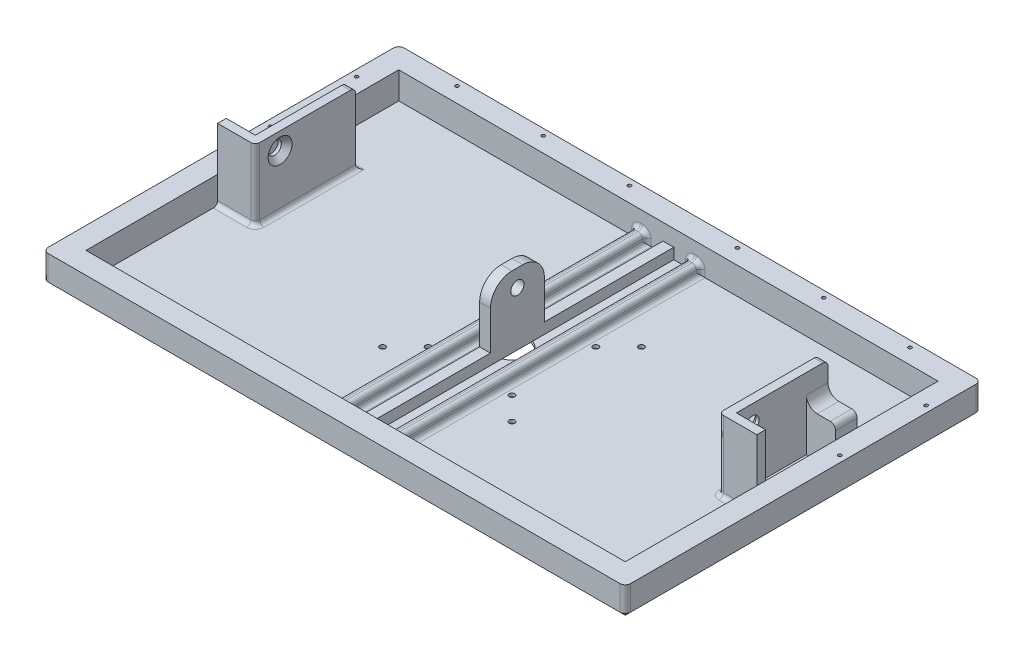
from build123d import *

# Parameters (mm, degrees)
SKETCH1_W           = 540
SKETCH1_H           = 330
BOSS_EXTRUDE1_DEPTH = 3
SKETCH2_W           = 540
SKETCH2_H           = 330
SKETCH2_W_2         = 500
SKETCH2_H_2         = 290
BOSS_EXTRUDE2_DEPTH = 25
FILLET1_R           = 5
SKETCH4_R           = 1.6
CUT_EXTRUDE1_DEPTH  = 28
SKETCH5_R           = 15
CUT_EXTRUDE2_DEPTH  = 3
SKETCH6_W           = 10
SKETCH6_H           = 290
BOSS_EXTRUDE3_DEPTH = 10
FILLET3_R           = 4
CHAMFER1_SIZE       = 5
SKETCH7_R           = 2.6
CUT_EXTRUDE3_DEPTH  = 3
SKETCH9_R           = 2.6
CUT_EXTRUDE4_DEPTH  = 47
SKETCH11_W          = 8
SKETCH11_H          = 140
BOSS_EXTRUDE4_DEPTH = 66
SKETCH12_R          = 6.1
CUT_EXTRUDE5_DEPTH  = 8
SKETCH13_W          = 8
SKETCH13_H          = 69
SKETCH13_W_2        = 20
SKETCH13_H_2        = 40.75
BOSS_EXTRUDE5_DEPTH = 27
SKETCH15_W          = 8
SKETCH15_H          = 47
CUT_EXTRUDE6_DEPTH  = 66
FILLET4_R           = 4
FILLET5_R           = 10
FILLET6_R           = 5
FILLET7_R           = 5
CHAMFER2_SIZE       = 5
SKETCH19_W          = 10
SKETCH19_H          = 290
BOSS_EXTRUDE6_DEPTH = 10
SKETCH20_W          = 10
SKETCH20_H          = 50
BOSS_EXTRUDE7_DEPTH = 56
FILLET8_R           = 20
SKETCH21_R          = 6.1
CUT_EXTRUDE7_DEPTH  = 10


with BuildPart() as part:
    # Sketch1 → Boss-Extrude1 (new body)
    with BuildSketch(Plane(origin=(0, 0, 0), x_dir=(1, 0, 0), z_dir=(0, 1, 0))):
        Rectangle(SKETCH1_W, SKETCH1_H)
    extrude(amount=BOSS_EXTRUDE1_DEPTH)

    # Sketch2 → Boss-Extrude2 (add)
    with BuildSketch(Plane(origin=(0, 3, 0), x_dir=(1, 0, 0), z_dir=(0, 1, 0))):
        Rectangle(SKETCH2_W, SKETCH2_H)
        Rectangle(SKETCH2_W_2, SKETCH2_H_2, mode=Mode.SUBTRACT)
    extrude(amount=BOSS_EXTRUDE2_DEPTH)

    # Fillet1
    fillet1_edges = [part.edges().sort_by_distance(p)[0] for p in [
        (270, 14, 165),
        (-270, 14, 165),
        (-270, 14, -165),
        (270, 14, -165),
    ]]
    fillet(fillet1_edges, radius=FILLET1_R)

    # Sketch4 → Cut-Extrude1 (cut)
    with BuildSketch(Plane(origin=(0, 28, 0), x_dir=(1, 0, 0), z_dir=(0, 1, 0))):
        with Locations(Location((-264, 120, 0), (0, 0, 270))):
            Circle(SKETCH4_R)
        with Locations(Location((-264, 40, 0), (0, 0, 270))):
            Circle(SKETCH4_R)
        with Locations(Location((-210, 159, 0), (0, 0, 270))):
            Circle(SKETCH4_R)
        with Locations(Location((-130, 159, 0), (0, 0, 270))):
            Circle(SKETCH4_R)
        with Locations(Location((-50, 159, 0), (0, 0, 270))):
            Circle(SKETCH4_R)
        with Locations(Location((50, 159, 0), (0, 0, 90))):
            Circle(SKETCH4_R)
        with Locations(Location((130, 159, 0), (0, 0, 90))):
            Circle(SKETCH4_R)
        with Locations(Location((210, 159, 0), (0, 0, 90))):
            Circle(SKETCH4_R)
        with Locations(Location((264, 40, 0), (0, 0, 90))):
            Circle(SKETCH4_R)
        with Locations(Location((264, 120, 0), (0, 0, 90))):
            Circle(SKETCH4_R)
    extrude(amount=-CUT_EXTRUDE1_DEPTH, mode=Mode.SUBTRACT)

    # Sketch5 → Cut-Extrude2 (cut)
    with BuildSketch(Plane(origin=(0, 3, 0), x_dir=(1, 0, 0), z_dir=(0, 1, 0))):
        with Locations(Location((0, 0, 0), (0, 0, 270))):
            Circle(SKETCH5_R)
    extrude(amount=-CUT_EXTRUDE2_DEPTH, mode=Mode.SUBTRACT)

    # Sketch6 → Boss-Extrude3 (add)
    with BuildSketch(Plane(origin=(0, 3, 0), x_dir=(1, 0, 0), z_dir=(0, 1, 0))):
        with Locations((25, 0)):
            Rectangle(SKETCH6_W, SKETCH6_H)
        with Locations((-25, 0)):
            Rectangle(SKETCH6_W, SKETCH6_H)
    extrude(amount=BOSS_EXTRUDE3_DEPTH)

    # Fillet3
    fillet3_edges = [part.edges().sort_by_distance(p)[0] for p in [
        (30, 3, 0),
        (30, 8, 145),
        (30, 8, -145),
        (20, 3, 0),
        (20, 8, -145),
        (20, 8, 145),
        (30, 13, 0),
        (25, 13, -145),
        (20, 13, 0),
        (25, 13, 145),
        (-20, 3, 0),
        (-20, 8, 145),
        (-20, 8, -145),
        (-30, 3, 0),
        (-30, 8, -145),
        (-30, 8, 145),
        (-20, 13, 0),
        (-25, 13, -145),
        (-30, 13, 0),
        (-25, 13, 145),
    ]]
    fillet(fillet3_edges, radius=FILLET3_R)

    # Chamfer1
    # the kernel refuses this chamfer: 5 mm, written as the material it takes off along each edge
    with BuildSketch(Plane(origin=(-270, 0, -160), x_dir=(0, 1, 0), z_dir=(0, 0, 1)), Plane(origin=(270, 0, 160), x_dir=(0, 1, 0), z_dir=(0, 0, -1))) as chamfer1_piece_1:
        Polygon((CHAMFER1_SIZE, 0), (0, -CHAMFER1_SIZE), (0, 0), align=None)
    extrude(amount=320, mode=Mode.SUBTRACT)
    with BuildSketch(Plane(origin=(-265, 0, 165), x_dir=(0, 1, 0), z_dir=(1, 0, 0)), Plane(origin=(265, 0, -165), x_dir=(0, 1, 0), z_dir=(-1, 0, 0))) as chamfer1_piece_2:
        Polygon((CHAMFER1_SIZE, 0), (0, -CHAMFER1_SIZE), (0, 0), align=None)
    extrude(amount=530, mode=Mode.SUBTRACT)
    with BuildSketch(Plane(origin=(265, 0, -160), x_dir=(0, 0, -1), z_dir=(-1, 0, 0))) as chamfer1_piece_3:
        Polygon((5, -CHAMFER1_SIZE), (5 - CHAMFER1_SIZE, 0), (5, 0), align=None)
    revolve(axis=Axis((265, 0, -160), (0, -1, 0)), revolution_arc=90, mode=Mode.SUBTRACT)
    with BuildSketch(Plane(origin=(265, 0, 160), x_dir=(0, 0, 1), z_dir=(-1, 0, 0))) as chamfer1_piece_4:
        Polygon((5, CHAMFER1_SIZE), (5 - CHAMFER1_SIZE, 0), (5, 0), align=None)
    revolve(axis=Axis((265, 0, 160), (0, 1, 0)), revolution_arc=90, mode=Mode.SUBTRACT)
    with BuildSketch(Plane(origin=(-265, 0, 160), x_dir=(0, 0, 1), z_dir=(1, 0, 0))) as chamfer1_piece_5:
        Polygon((5, -CHAMFER1_SIZE), (5 - CHAMFER1_SIZE, 0), (5, 0), align=None)
    revolve(axis=Axis((-265, 0, 160), (0, -1, 0)), revolution_arc=90, mode=Mode.SUBTRACT)
    with BuildSketch(Plane(origin=(-265, 0, -160), x_dir=(0, 0, -1), z_dir=(1, 0, 0))) as chamfer1_piece_6:
        Polygon((5, CHAMFER1_SIZE), (5 - CHAMFER1_SIZE, 0), (5, 0), align=None)
    revolve(axis=Axis((-265, 0, -160), (0, 1, 0)), revolution_arc=90, mode=Mode.SUBTRACT)

    # Sketch7 → Cut-Extrude3 (cut)
    with BuildSketch(Plane.XZ):
        with Locations(Location((-60, 60, 0), (0, 0, 270))):
            Circle(SKETCH7_R)
        with Locations(Location((60, 60, 0), (0, 0, 270))):
            Circle(SKETCH7_R)
        with Locations(Location((60, -60, 0), (0, 0, 270))):
            Circle(SKETCH7_R)
        with Locations(Location((-60, -60, 0), (0, 0, 270))):
            Circle(SKETCH7_R)
    extrude(amount=-CUT_EXTRUDE3_DEPTH, mode=Mode.SUBTRACT)

    # Sketch9 → Cut-Extrude4 (cut)
    with BuildSketch(Plane.XZ):
        with Locations(Location((-38.890872965, 38.890872965, 0), (0, 0, 270))):
            Circle(SKETCH9_R)
        with Locations(Location((38.890872965, 38.890872965, 0), (0, 0, 270))):
            Circle(SKETCH9_R)
        with Locations(Location((38.890872965, -38.890872965, 0), (0, 0, 270))):
            Circle(SKETCH9_R)
        with Locations(Location((-38.890872965, -38.890872965, 0), (0, 0, 270))):
            Circle(SKETCH9_R)
    extrude(amount=-CUT_EXTRUDE4_DEPTH, mode=Mode.SUBTRACT)

    # Sketch11 → Boss-Extrude4 (add)
    with BuildSketch(Plane(origin=(0, 3, 0), x_dir=(1, 0, 0), z_dir=(0, 1, 0))):
        with Locations((-219, 0)):
            Rectangle(SKETCH11_W, SKETCH11_H)
    extrude(amount=BOSS_EXTRUDE4_DEPTH)

    # Sketch12 → Cut-Extrude5 (cut)
    with BuildSketch(Plane.ZY.offset(223)):
        with Locations((0, 53)):
            Circle(SKETCH12_R)
    extrude(amount=-CUT_EXTRUDE5_DEPTH, mode=Mode.SUBTRACT)

    # Sketch13 → Boss-Extrude5 (add)
    with BuildSketch(Plane.ZY.offset(223)):
        with Locations((19, 34.5)):
            Rectangle(SKETCH13_W, SKETCH13_H)
        with Locations((-60, 20.375)):
            Rectangle(SKETCH13_W_2, SKETCH13_H_2)
    extrude(amount=BOSS_EXTRUDE5_DEPTH)

    # Sketch15 → Cut-Extrude6 (cut)
    with BuildSketch(Plane(origin=(0, 69, 0), x_dir=(1, 0, 0), z_dir=(0, 1, 0))):
        with Locations((-219, -46.5)):
            Rectangle(SKETCH15_W, SKETCH15_H)
    extrude(amount=-CUT_EXTRUDE6_DEPTH, mode=Mode.SUBTRACT)

    # Fillet4
    fillet4_edges = [part.edges().sort_by_distance(p)[0] for p in [
        (-232.5, 3, -70),
        (-232.5, 3, 23),
        (-215, 3, -23.5),
        (-215, 36, 23),
    ]]
    fillet(fillet4_edges, radius=FILLET4_R)

    # Fillet5
    fillet5_edges = [part.edges().sort_by_distance(p)[0] for p in [
        (-223, 40.75, -60),
    ]]
    fillet(fillet5_edges, radius=FILLET5_R)

    # Fillet6
    fillet6_edges = [part.edges().sort_by_distance(p)[0] for p in [
        (-250, 40.75, -60),
    ]]
    fillet(fillet6_edges, radius=FILLET6_R)

    # Fillet7
    fillet7_edges = [part.edges().sort_by_distance(p)[0] for p in [
        (-219, 69, -70),
    ]]
    fillet(fillet7_edges, radius=FILLET7_R)

    # Chamfer2
    chamfer2_edges = [part.edges().sort_by_distance(p)[0] for p in [
        (-215, 53, -6.1),
    ]]
    chamfer(chamfer2_edges, length=CHAMFER2_SIZE)

    # Mirror9: part across plane


with BuildPart() as part_1:
    add(part.part)
    add(part.part.mirror(Plane(origin=(0, 0, 0), x_dir=(0, 0, 1), z_dir=(1, 0, 0))))

    # Sketch19 → Boss-Extrude6 (add)
    with BuildSketch(Plane(origin=(0, 3, 0), x_dir=(1, 0, 0), z_dir=(0, 1, 0))):
        Rectangle(SKETCH19_W, SKETCH19_H)
    extrude(amount=BOSS_EXTRUDE6_DEPTH)

    # Sketch20 → Boss-Extrude7 (add)
    with BuildSketch(Plane(origin=(0, 13, 0), x_dir=(1, 0, 0), z_dir=(0, 1, 0))):
        Rectangle(SKETCH20_W, SKETCH20_H)
    extrude(amount=BOSS_EXTRUDE7_DEPTH)

    # Fillet8
    fillet8_edges = [part_1.edges().sort_by_distance(p)[0] for p in [
        (0, 69, 25),
        (0, 69, -25),
    ]]
    fillet(fillet8_edges, radius=FILLET8_R)

    # Sketch21 → Cut-Extrude7 (cut)
    with BuildSketch(Plane.ZY.offset(5)):
        with Locations((0, 53)):
            Circle(SKETCH21_R)
    extrude(amount=-CUT_EXTRUDE7_DEPTH, mode=Mode.SUBTRACT)


solid = part_1.part
